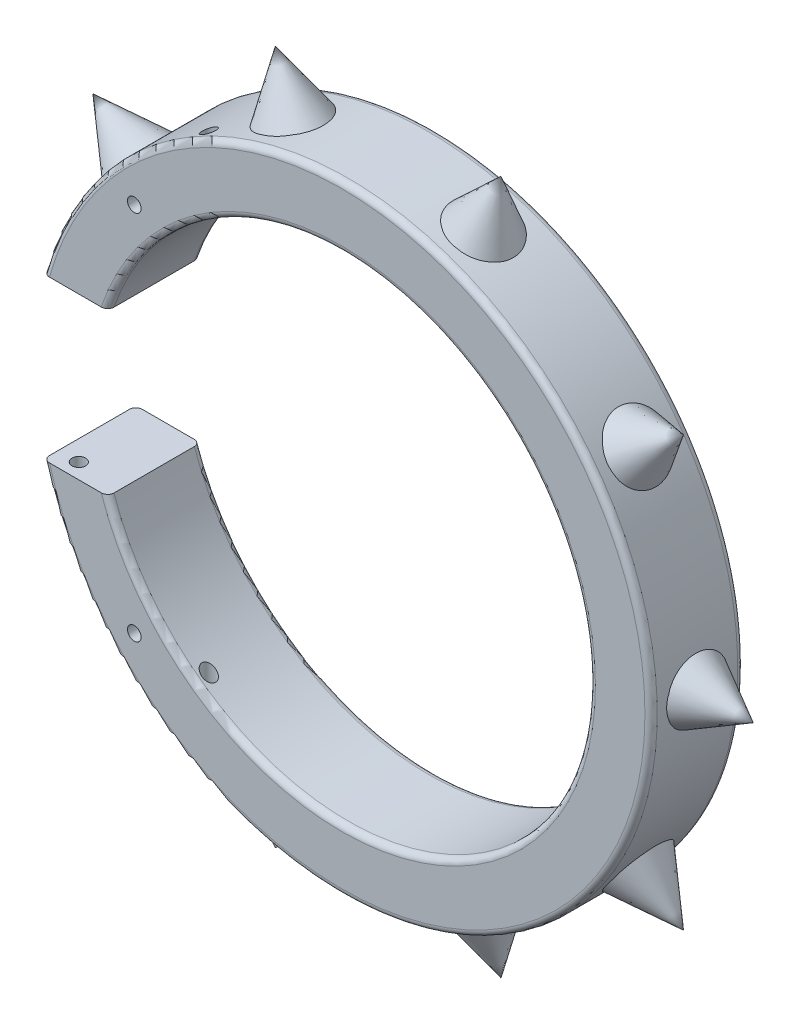
from build123d import *

# Parameters (mm, degrees)
SKETCH_1_R               = 50
SKETCH_1_R_2             = 40
EXTRUDE_1_DEPTH          = 15
FILLET_1_R               = 1
PATTERN_CIRCULAR_1_COUNT = 10
CUT_EXTRUDE_1_DEPTH      = 83.792475979
CUT_EXTRUDE_1_DEPTH_BACK = 83.792475979
SKETCH_3_R               = 1.1
SKETCH_4_R               = 1.1
CUT_EXTRUDE_2_DEPTH      = 83.792475979
SKETCH_5_W               = 46.379694223
SKETCH_5_H               = 40.831050276
CUT_EXTRUDE_3_DEPTH      = 26


with BuildPart() as part:
    # ｽｹｯﾁ1 → ﾎﾞｽ - 押し出し1 (new body)
    with BuildSketch(Plane.XY):
        Circle(SKETCH_1_R)
        Circle(SKETCH_1_R_2, mode=Mode.SUBTRACT)
    extrude(amount=EXTRUDE_1_DEPTH)

    # ﾌｨﾚｯﾄ1
    fillet_1_edges = [part.edges().sort_by_distance(p)[0] for p in [
        (-50, 0, 15),
        (-40, 0, 15),
        (-40, 0, 0),
        (-50, 0, 0),
    ]]
    fillet(fillet_1_edges, radius=FILLET_1_R)

    # ｽｹｯﾁ3 → ｶｯﾄ - 押し出し1 (cut, two sides: drawn at the far end of the back side and taken through both)
    with BuildSketch(Plane(origin=(0, 0, 0), x_dir=(1, 0, 0), z_dir=(0, 1, 0)).offset(-CUT_EXTRUDE_1_DEPTH_BACK)):
        with Locations((-45, -12.5)):
            Circle(SKETCH_3_R)
        with Locations((-24, -12.5)):
            Circle(SKETCH_3_R)
    extrude(amount=CUT_EXTRUDE_1_DEPTH + CUT_EXTRUDE_1_DEPTH_BACK, mode=Mode.SUBTRACT)

    # ｽｹｯﾁ4 → ｶｯﾄ - 押し出し2 (cut, through all)
    with BuildSketch(Plane(origin=(0, 0, 0), x_dir=(-1, 0, 0), z_dir=(0, 0, -1))):
        with Locations((33.541019662, -30)):
            Circle(SKETCH_4_R)
        with Locations((33.541019662, 30)):
            Circle(SKETCH_4_R)
    extrude(amount=-CUT_EXTRUDE_2_DEPTH, mode=Mode.SUBTRACT)


with BuildPart() as body_2:
    # ｽｹｯﾁ2 → 回転1 (revolve)
    with BuildSketch(Plane(origin=(0, 0, 0), x_dir=(1, 0, 0), z_dir=(0, 1, 0))):
        Polygon((-59, -7.5), (-49, -2), (-49, -7.5), align=None)
    revolve(axis=Axis((-59, 0, 7.5), (1, 0, 0)))


with BuildPart() as pattern_circular_1_1:
    # 円形ﾊﾟﾀｰﾝ1: pattern copy
    add(body_2.part.rotate(Axis((0, 0, -0.75), (0, 0, 1)), 1 * 360 / PATTERN_CIRCULAR_1_COUNT))


with BuildPart() as pattern_circular_1_2:
    # 円形ﾊﾟﾀｰﾝ1: pattern copy
    add(body_2.part.rotate(Axis((0, 0, -0.75), (0, 0, 1)), 2 * 360 / PATTERN_CIRCULAR_1_COUNT))


with BuildPart() as pattern_circular_1_3:
    # 円形ﾊﾟﾀｰﾝ1: pattern copy
    add(body_2.part.rotate(Axis((0, 0, -0.75), (0, 0, 1)), 3 * 360 / PATTERN_CIRCULAR_1_COUNT))


with BuildPart() as pattern_circular_1_4:
    # 円形ﾊﾟﾀｰﾝ1: pattern copy
    add(body_2.part.rotate(Axis((0, 0, -0.75), (0, 0, 1)), 4 * 360 / PATTERN_CIRCULAR_1_COUNT))


with BuildPart() as pattern_circular_1_5:
    # 円形ﾊﾟﾀｰﾝ1: pattern copy
    add(body_2.part.rotate(Axis((0, 0, -0.75), (0, 0, 1)), 5 * 360 / PATTERN_CIRCULAR_1_COUNT))


with BuildPart() as pattern_circular_1_6:
    # 円形ﾊﾟﾀｰﾝ1: pattern copy
    add(body_2.part.rotate(Axis((0, 0, -0.75), (0, 0, 1)), 6 * 360 / PATTERN_CIRCULAR_1_COUNT))


with BuildPart() as pattern_circular_1_7:
    # 円形ﾊﾟﾀｰﾝ1: pattern copy
    add(body_2.part.rotate(Axis((0, 0, -0.75), (0, 0, 1)), 7 * 360 / PATTERN_CIRCULAR_1_COUNT))


with BuildPart() as pattern_circular_1_8:
    # 円形ﾊﾟﾀｰﾝ1: pattern copy
    add(body_2.part.rotate(Axis((0, 0, -0.75), (0, 0, 1)), 8 * 360 / PATTERN_CIRCULAR_1_COUNT))


with BuildPart() as pattern_circular_1_9:
    # 円形ﾊﾟﾀｰﾝ1: pattern copy
    add(body_2.part.rotate(Axis((0, 0, -0.75), (0, 0, 1)), 9 * 360 / PATTERN_CIRCULAR_1_COUNT))


with BuildPart() as cut_extrude_3_tool:
    # ｽｹｯﾁ5 → ｶｯﾄ - 押し出し3 (new body)
    with BuildSketch(Plane(origin=(0, 13, 0), x_dir=(1, 0, 0), z_dir=(0, 1, 0))):
        with Locations((-49.860972606, -7.56022241)):
            Rectangle(SKETCH_5_W, SKETCH_5_H)
    extrude(amount=-CUT_EXTRUDE_3_DEPTH)


with BuildPart() as part_1:
    add(part.part)

    # ｶｯﾄ - 押し出し3: cut by cut_extrude_3_tool
    add(cut_extrude_3_tool.part, mode=Mode.SUBTRACT)


with BuildPart() as body_2_1:
    add(body_2.part)

    # ｶｯﾄ - 押し出し3: cut by cut_extrude_3_tool
    add(cut_extrude_3_tool.part, mode=Mode.SUBTRACT)


solid = Compound([pattern_circular_1_1.part, pattern_circular_1_2.part, pattern_circular_1_3.part, pattern_circular_1_4.part, pattern_circular_1_5.part, pattern_circular_1_6.part, pattern_circular_1_7.part, pattern_circular_1_8.part, pattern_circular_1_9.part, part_1.part])
